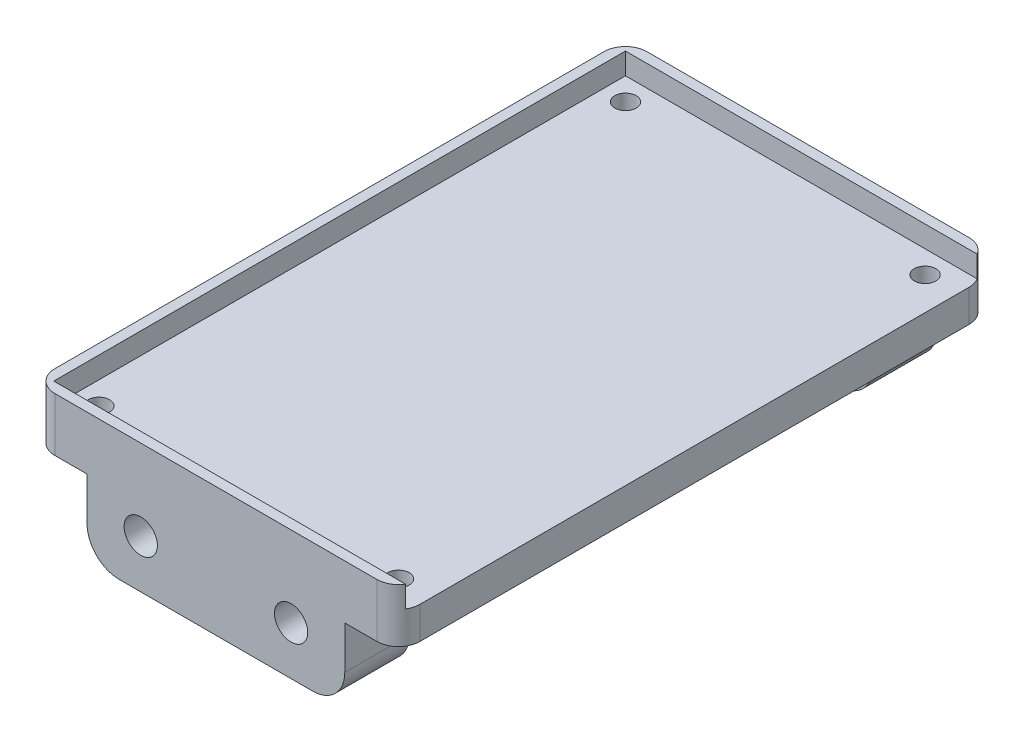
from build123d import *

# Parameters (mm, degrees)
SKETCH_1_W          = 34
SKETCH_1_H          = 55.14
EXTRUDE_1_DEPTH     = 5
SKETCH_2_W          = 32.1
SKETCH_2_H          = 53.24
CUT_EXTRUDE_1_DEPTH = 2
SKETCH_3_W          = 50
SKETCH_3_H          = 10
CUT_EXTRUDE_2_DEPTH = 2
FILLET_3_R          = 2
FILLET_4_R          = 2
FILLET_5_R          = 2
FILLET_6_R          = 2
SKETCH_5_R          = 1
CUT_EXTRUDE_3_DEPTH = 5
CUT_EXTRUDE_5_DEPTH = 5
SKETCH_7_W          = 24.577640881
SKETCH_7_H          = 46.089683544
EXTRUDE_3_DEPTH     = 3
EXTRUDE_5_DEPTH     = 5
EXTRUDE_6_DEPTH     = 5
SKETCH_10_R         = 2
CUT_EXTRUDE_6_DEPTH = 65.972452624
SKETCH_11_W         = 2
SKETCH_11_H         = 50
EXTRUDE_7_DEPTH     = 3
SKETCH_12_W         = 2
SKETCH_12_H         = 5
EXTRUDE_8_DEPTH     = 6
SKETCH_13_W         = 2
SKETCH_13_H         = 5
EXTRUDE_9_DEPTH     = 6
SKETCH_14_W         = 24
SKETCH_14_H         = 6
EXTRUDE_10_DEPTH    = 2
SKETCH_15_R         = 2
SKETCH_15_R_2       = 1.55
EXTRUDE_11_DEPTH    = 6
SKETCH_16_R         = 2
SKETCH_16_R_2       = 1.55
EXTRUDE_12_DEPTH    = 6
EXTRUDE_START       = -6
SKETCH_17_R         = 2
SKETCH_17_R_2       = 1.55
EXTRUDE_13_DEPTH    = 6
FILLET_7_R          = 3
FILLET_8_R          = 3
FILLET_9_R          = 3
FILLET_10_R         = 3
SKETCH_18_W         = 1.621272793
SKETCH_18_H         = 53.24
CUT_EXTRUDE_7_DEPTH = 2


with BuildPart() as part:
    # 草图1 → 凸台-拉伸1 (new body)
    with BuildSketch(Plane(origin=(0, 0, 0), x_dir=(1, 0, 0), z_dir=(0, 1, 0))):
        with Locations((17, 27.57)):
            Rectangle(SKETCH_1_W, SKETCH_1_H)
    extrude(amount=EXTRUDE_1_DEPTH)

    # 草图2 → 切除-拉伸1 (cut)
    with BuildSketch(Plane(origin=(0, 5, 0), x_dir=(1, 0, 0), z_dir=(0, 1, 0))):
        with Locations((17, 27.57)):
            Rectangle(SKETCH_2_W, SKETCH_2_H)
    extrude(amount=-CUT_EXTRUDE_1_DEPTH, mode=Mode.SUBTRACT)

    # 草图3 → 切除-拉伸2 (cut)
    with BuildSketch(Plane(origin=(34, 0, 0), x_dir=(0, 0, -1), z_dir=(1, 0, 0))):
        with Locations((27.57, 5)):
            Rectangle(SKETCH_3_W, SKETCH_3_H)
    extrude(amount=-CUT_EXTRUDE_2_DEPTH, mode=Mode.SUBTRACT)

    # 圆角3
    fillet_3_edges = [part.edges().sort_by_distance(p)[0] for p in [
        (0, 2.5, 0),
    ]]
    fillet(fillet_3_edges, radius=FILLET_3_R)

    # 圆角4
    fillet_4_edges = [part.edges().sort_by_distance(p)[0] for p in [
        (0, 2.5, -55.14),
    ]]
    fillet(fillet_4_edges, radius=FILLET_4_R)

    # 圆角5
    fillet_5_edges = [part.edges().sort_by_distance(p)[0] for p in [
        (34, 2.5, -55.14),
    ]]
    fillet(fillet_5_edges, radius=FILLET_5_R)

    # 圆角6
    fillet_6_edges = [part.edges().sort_by_distance(p)[0] for p in [
        (34, 2.5, 0),
    ]]
    fillet(fillet_6_edges, radius=FILLET_6_R)

    # 草图5 → 切除-拉伸3 (cut)
    with BuildSketch(Plane(origin=(0, 3, 0), x_dir=(1, 0, 0), z_dir=(0, 1, 0))):
        with Locations((3.05, 52.09)):
            Circle(SKETCH_5_R)
        with Locations((3.05, 3.05)):
            Circle(SKETCH_5_R)
        with Locations((30.95, 3.05)):
            Circle(SKETCH_5_R)
        with Locations((30.95, 52.09)):
            Circle(SKETCH_5_R)
    extrude(amount=-CUT_EXTRUDE_3_DEPTH, mode=Mode.SUBTRACT)

    # 草图6 → 切除-拉伸5 (cut)
    with BuildSketch(Plane(origin=(0, 3, 0), x_dir=(1, 0, 0), z_dir=(0, 1, 0))):
        with BuildLine():
            ThreePointArc((6.05, 50.09), (5.342893219, 49.797106781), (5.05, 49.09))
            Line((5.05, 49.09), (5.05, 6.05))
            ThreePointArc((5.05, 6.05), (5.342893219, 5.342893219), (6.05, 5.05))
            Line((6.05, 5.05), (6.254717451, 5.05))
            ThreePointArc((6.254717451, 5.05), (6.961824232, 5.342893219), (7.254717451, 6.05))
            Line((7.254717451, 6.05), (7.254717451, 49.09))
            ThreePointArc((7.254717451, 49.09), (6.961824232, 49.797106781), (6.254717451, 50.09))
            Line((6.254717451, 50.09), (6.05, 50.09))
        make_face()
        with BuildLine():
            ThreePointArc((11.05, 50.09), (10.342893219, 49.797106781), (10.05, 49.09))
            Line((10.05, 49.09), (10.05, 6.05))
            ThreePointArc((10.05, 6.05), (10.342893219, 5.342893219), (11.05, 5.05))
            Line((11.05, 5.05), (11.254717451, 5.05))
            ThreePointArc((11.254717451, 5.05), (11.961824232, 5.342893219), (12.254717451, 6.05))
            Line((12.254717451, 6.05), (12.254717451, 49.09))
            ThreePointArc((12.254717451, 49.09), (11.961824232, 49.797106781), (11.254717451, 50.09))
            Line((11.254717451, 50.09), (11.05, 50.09))
        make_face()
        with BuildLine():
            ThreePointArc((16.05, 50.09), (15.342893219, 49.797106781), (15.05, 49.09))
            Line((15.05, 49.09), (15.05, 6.05))
            ThreePointArc((15.05, 6.05), (15.342893219, 5.342893219), (16.05, 5.05))
            Line((16.05, 5.05), (16.254717451, 5.05))
            ThreePointArc((16.254717451, 5.05), (16.961824232, 5.342893219), (17.254717451, 6.05))
            Line((17.254717451, 6.05), (17.254717451, 49.09))
            ThreePointArc((17.254717451, 49.09), (16.961824232, 49.797106781), (16.254717451, 50.09))
            Line((16.254717451, 50.09), (16.05, 50.09))
        make_face()
        with BuildLine():
            ThreePointArc((21.05, 50.09), (20.342893219, 49.797106781), (20.05, 49.09))
            Line((20.05, 49.09), (20.05, 6.05))
            ThreePointArc((20.05, 6.05), (20.342893219, 5.342893219), (21.05, 5.05))
            Line((21.05, 5.05), (21.254717451, 5.05))
            ThreePointArc((21.254717451, 5.05), (21.961824232, 5.342893219), (22.254717451, 6.05))
            Line((22.254717451, 6.05), (22.254717451, 49.09))
            ThreePointArc((22.254717451, 49.09), (21.961824232, 49.797106781), (21.254717451, 50.09))
            Line((21.254717451, 50.09), (21.05, 50.09))
        make_face()
        with BuildLine():
            ThreePointArc((26.05, 50.09), (25.342893219, 49.797106781), (25.05, 49.09))
            Line((25.05, 49.09), (25.05, 6.05))
            ThreePointArc((25.05, 6.05), (25.342893219, 5.342893219), (26.05, 5.05))
            Line((26.05, 5.05), (26.254717451, 5.05))
            ThreePointArc((26.254717451, 5.05), (26.961824232, 5.342893219), (27.254717451, 6.05))
            Line((27.254717451, 6.05), (27.254717451, 49.09))
            ThreePointArc((27.254717451, 49.09), (26.961824232, 49.797106781), (26.254717451, 50.09))
            Line((26.254717451, 50.09), (26.05, 50.09))
        make_face()
    extrude(amount=-CUT_EXTRUDE_5_DEPTH, mode=Mode.SUBTRACT)

    # 草图7 → 凸台-拉伸3 (add)
    with BuildSketch(Plane.XZ):
        with Locations((15.625766317, -27.57)):
            Rectangle(SKETCH_7_W, SKETCH_7_H)
    extrude(amount=-EXTRUDE_3_DEPTH)

    # 草图8 → 凸台-拉伸5 (add)
    with BuildSketch(Plane.XZ):
        Polygon((7, 0), (7, -6), (27, -6), (27, 0), (17, 0), align=None)
    extrude(amount=EXTRUDE_5_DEPTH)

    # 草图9 → 凸台-拉伸6 (add)
    with BuildSketch(Plane.XZ):
        Polygon((7, -49.14), (7, -55.14), (17, -55.14), (27, -55.14), (27, -49.14), align=None)
    extrude(amount=EXTRUDE_6_DEPTH)

    # 草图10 → 切除-拉伸6 (cut, through all)
    with BuildSketch(Plane(origin=(0, 0, -55.14), x_dir=(-1, 0, 0), z_dir=(0, 0, -1))):
        with Locations((-24, -2.5)):
            Circle(SKETCH_10_R)
        with Locations((-10, -2.5)):
            Circle(SKETCH_10_R)
    extrude(amount=-CUT_EXTRUDE_6_DEPTH, mode=Mode.SUBTRACT)

    # 草图11 → 凸台-拉伸7 (add)
    with BuildSketch(Plane.XZ):
        with Locations((33, -27.57)):
            Rectangle(SKETCH_11_W, SKETCH_11_H)
    extrude(amount=-EXTRUDE_7_DEPTH)

    # 草图12 → 凸台-拉伸8 (add)
    with BuildSketch(Plane(origin=(0, 0, -55.14), x_dir=(-1, 0, 0), z_dir=(0, 0, -1))):
        with Locations((-28, -2.5)):
            Rectangle(SKETCH_12_W, SKETCH_12_H)
        with Locations((-6, -2.5)):
            Rectangle(SKETCH_12_W, SKETCH_12_H)
    extrude(amount=-EXTRUDE_8_DEPTH)

    # 草图13 → 凸台-拉伸9 (add)
    with BuildSketch(Plane.XY):
        with Locations((6, -2.5)):
            Rectangle(SKETCH_13_W, SKETCH_13_H)
        with Locations((28, -2.5)):
            Rectangle(SKETCH_13_W, SKETCH_13_H)
    extrude(amount=-EXTRUDE_9_DEPTH)

    # 草图14 → 凸台-拉伸10 (add)
    with BuildSketch(Plane.XZ.offset(5)):
        with Locations((17, -3)):
            Rectangle(SKETCH_14_W, SKETCH_14_H)
        with Locations((17, -52.14)):
            Rectangle(SKETCH_14_W, SKETCH_14_H)
    extrude(amount=EXTRUDE_10_DEPTH)

    # 草图15 → 凸台-拉伸11 (add)
    with BuildSketch(Plane(origin=(0, 0, -55.14), x_dir=(-1, 0, 0), z_dir=(0, 0, -1))):
        with Locations((-24, -2.5)):
            Circle(SKETCH_15_R)
        with Locations((-24, -2.5)):
            Circle(SKETCH_15_R_2, mode=Mode.SUBTRACT)
    extrude(amount=-EXTRUDE_11_DEPTH)

    # 草图16 → 凸台-拉伸12 (add)
    with BuildSketch(Plane(origin=(0, 0, -55.14), x_dir=(-1, 0, 0), z_dir=(0, 0, -1))):
        with Locations((-10, -2.5)):
            Circle(SKETCH_16_R)
        with Locations((-10, -2.5)):
            Circle(SKETCH_16_R_2, mode=Mode.SUBTRACT)
    extrude(amount=-EXTRUDE_12_DEPTH)

    # 草图17 → 凸台-拉伸13 (add)
    # profile 1 of 2: a face of its own
    with BuildSketch(Plane.XY.offset(EXTRUDE_START)):
        with Locations((10, -2.5)):
            Circle(SKETCH_17_R)
        with Locations((10, -2.5)):
            Circle(SKETCH_17_R_2, mode=Mode.SUBTRACT)
    # profile 2 of 2: a face of its own
    with BuildSketch(Plane.XY.offset(EXTRUDE_START)):
        with Locations((24, -2.5)):
            Circle(SKETCH_17_R)
        with Locations((24, -2.5)):
            Circle(SKETCH_17_R_2, mode=Mode.SUBTRACT)
    extrude(amount=EXTRUDE_13_DEPTH)

    # 圆角7
    fillet_7_edges = [part.edges().sort_by_distance(p)[0] for p in [
        (5, -7, -52.14),
    ]]
    fillet(fillet_7_edges, radius=FILLET_7_R)

    # 圆角8
    fillet_8_edges = [part.edges().sort_by_distance(p)[0] for p in [
        (29, -7, -52.14),
    ]]
    fillet(fillet_8_edges, radius=FILLET_8_R)

    # 圆角9
    fillet_9_edges = [part.edges().sort_by_distance(p)[0] for p in [
        (29, -7, -3),
    ]]
    fillet(fillet_9_edges, radius=FILLET_9_R)

    # 圆角10
    fillet_10_edges = [part.edges().sort_by_distance(p)[0] for p in [
        (5, -7, -3),
    ]]
    fillet(fillet_10_edges, radius=FILLET_10_R)

    # 草图18 → 切除-拉伸7 (cut)
    with BuildSketch(Plane(origin=(0, 3, 0), x_dir=(1, 0, 0), z_dir=(0, 1, 0))):
        with Locations((33.860636396, 27.57)):
            Rectangle(SKETCH_18_W, SKETCH_18_H)
    extrude(amount=CUT_EXTRUDE_7_DEPTH, mode=Mode.SUBTRACT)


solid = part.part
